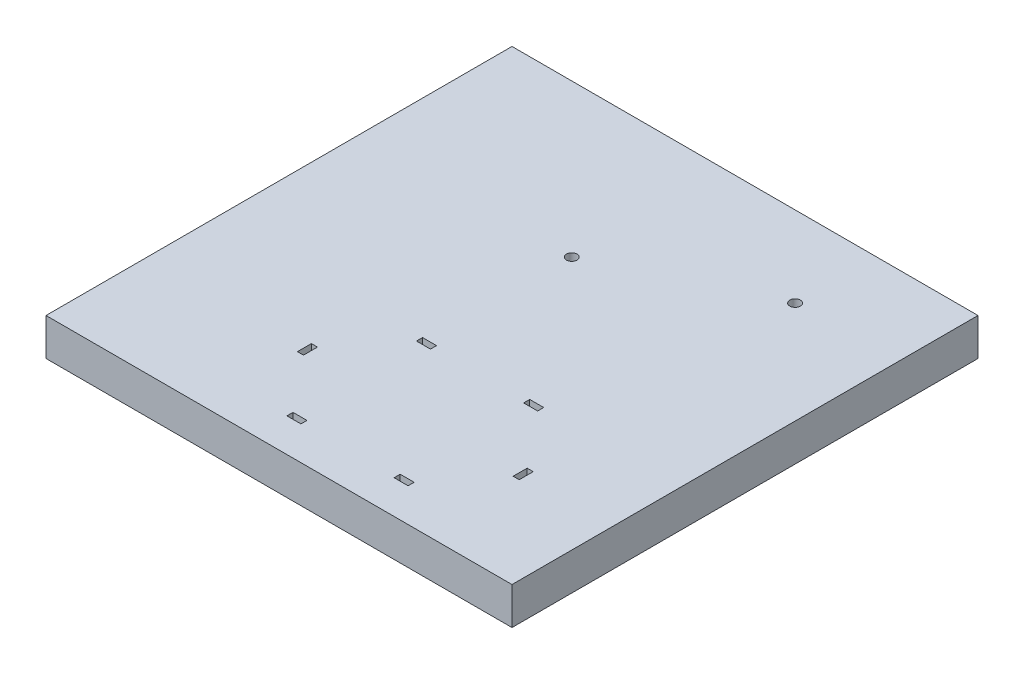
from build123d import *

# Parameters (mm, degrees)
SKETCH1_W           = 100
SKETCH1_H           = 100
SKETCH1_R           = 1.13
SKETCH1_W_2         = 3
SKETCH1_H_2         = 1.3
SKETCH1_W_3         = 1.3
SKETCH1_H_3         = 3
BOSS_EXTRUDE1_DEPTH = 8


with BuildPart() as part:
    # Sketch1 → Boss-Extrude1 (new body)
    with BuildSketch(Plane(origin=(0, 0, 0), x_dir=(1, 0, 0), z_dir=(0, 1, 0))):
        Rectangle(SKETCH1_W, SKETCH1_H)
        with Locations((28.07, 32.68)):
            Circle(SKETCH1_R, mode=Mode.SUBTRACT)
        with Locations((-4.44, 17.26)):
            Circle(SKETCH1_R, mode=Mode.SUBTRACT)
        with Locations((-4, -42.15)):
            Rectangle(SKETCH1_W_2, SKETCH1_H_2, mode=Mode.SUBTRACT)
        with Locations((-4, -14.35)):
            Rectangle(SKETCH1_W_2, SKETCH1_H_2, mode=Mode.SUBTRACT)
        with Locations((19, -14.35)):
            Rectangle(SKETCH1_W_2, SKETCH1_H_2, mode=Mode.SUBTRACT)
        with Locations((19, -42.15)):
            Rectangle(SKETCH1_W_2, SKETCH1_H_2, mode=Mode.SUBTRACT)
        with Locations((30.65, -28.25)):
            Rectangle(SKETCH1_W_3, SKETCH1_H_3, mode=Mode.SUBTRACT)
        with Locations((-15.65, -28.25)):
            Rectangle(SKETCH1_W_3, SKETCH1_H_3, mode=Mode.SUBTRACT)
    extrude(amount=BOSS_EXTRUDE1_DEPTH)


solid = part.part
